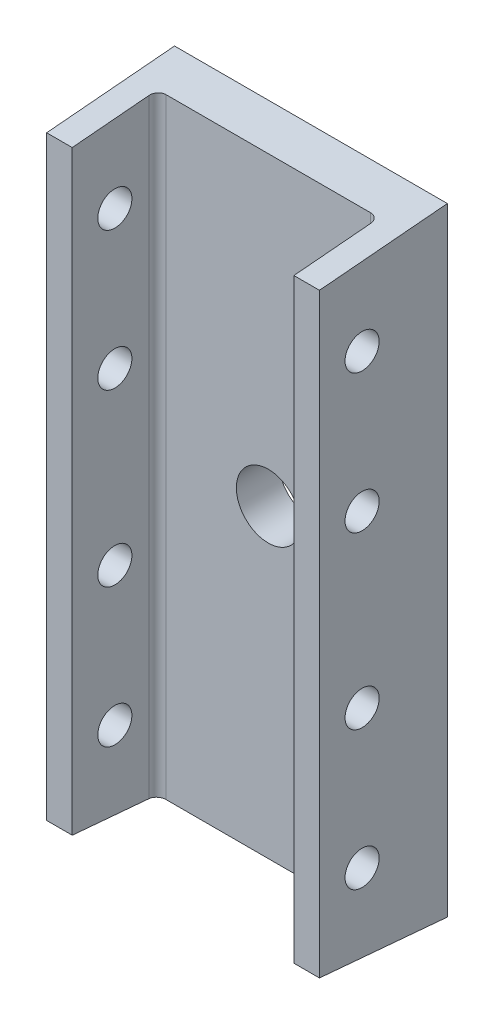
from build123d import *

# Parameters (mm, degrees)
SKETCH1_W               = 32
SKETCH1_H               = 72.48
SKETCH1_R               = 3.75
BOSS_EXTRUDE1_DEPTH     = 5
SKETCH2_W               = 3
SKETCH2_H               = 72.48
BOSS_EXTRUDE2_DEPTH     = 10
CUT_EXTRUDE1_DEPTH      = 49.77845426
CUT_EXTRUDE1_DEPTH_BACK = 49.77845426
SKETCH3_R               = 2
CUT_EXTRUDE2_DEPTH      = 51.61953773
FILLET1_R               = 1


with BuildPart() as part:
    # Sketch1 → Boss-Extrude1 (new body)
    with BuildSketch(Plane.XY):
        Rectangle(SKETCH1_W, SKETCH1_H)
        Circle(SKETCH1_R, mode=Mode.SUBTRACT)
    extrude(amount=BOSS_EXTRUDE1_DEPTH)

    # Sketch2 → Boss-Extrude2 (add)
    with BuildSketch(Plane.XY.offset(5)):
        with Locations((-14.5, 0)):
            Rectangle(SKETCH2_W, SKETCH2_H)
        with Locations((14.5, 0)):
            Rectangle(SKETCH2_W, SKETCH2_H)
    extrude(amount=BOSS_EXTRUDE2_DEPTH)

    # Sketch3 → Cut-Extrude1 (cut, two sides: drawn at the far end of the back side and taken through both)
    with BuildSketch(Plane(origin=(-13, 0, 0), x_dir=(0, 0, -1), z_dir=(1, 0, 0)).offset(-CUT_EXTRUDE1_DEPTH_BACK)):
        with Locations((-10, 26.24)):
            Circle(SKETCH3_R)
        with Locations((-10, 10)):
            Circle(SKETCH3_R)
        with Locations((-10, -10)):
            Circle(SKETCH3_R)
        with Locations((-10, -26.24)):
            Circle(SKETCH3_R)
    extrude(amount=CUT_EXTRUDE1_DEPTH + CUT_EXTRUDE1_DEPTH_BACK, mode=Mode.SUBTRACT)

    # Sketch4 → Cut-Extrude2 (cut, through all)
    with BuildSketch(Plane.ZY.offset(16)):
        Polygon((0, 36.24), (15, 34.927670047), (15, 36.24), align=None)
        Polygon((15, -36.24), (0, -36.24), (15, -34.927670047), align=None)
    extrude(amount=-CUT_EXTRUDE2_DEPTH, mode=Mode.SUBTRACT)

    # Fillet1
    fillet1_edges = [part.edges().sort_by_distance(p)[0] for p in [
        (13, 0, 5),
        (-13, 0, 5),
    ]]
    fillet(fillet1_edges, radius=FILLET1_R)


solid = part.part
